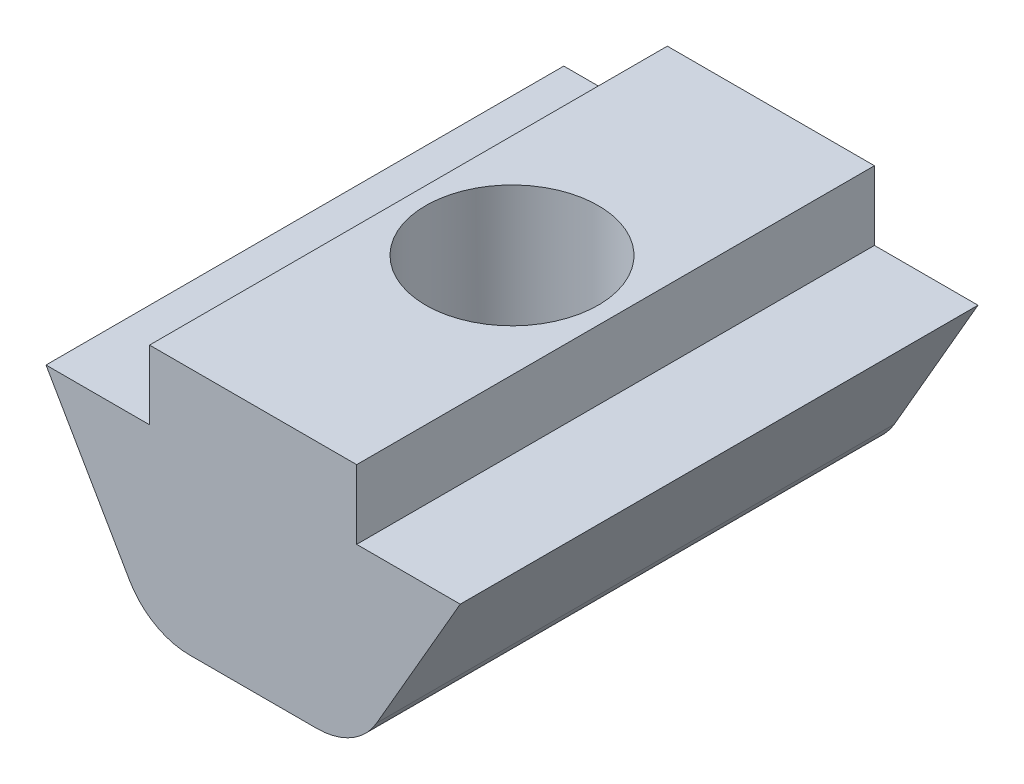
from build123d import *

# Parameters (mm, degrees)
BOSS_EXTRUDE1_DEPTH = 7.5
M6_TAPPED_HOLE1_D   = 5
FILLET1_R           = 2


with BuildPart() as part:
    # Sketch2 → Boss-Extrude1 (new, symmetric)
    with BuildSketch(Plane.XY):
        Polygon((-6, 5.196152423), (-3, 0), (3, 0), (6, 5.196152423), (3, 5.196152423), (3, 7.196152423), (-3, 7.196152423), (-3, 5.196152423), align=None)
    extrude(amount=BOSS_EXTRUDE1_DEPTH, both=True)

    # M6 Tapped Hole1 (through all)
    with Locations(Plane(origin=(0, 7.196152423, 0), x_dir=(1, 0, 0), z_dir=(0, 1, 0))):
        with Locations((0, 0)):
            Hole(M6_TAPPED_HOLE1_D / 2)

    # Fillet1
    # the kernel refuses this fillet: 2 mm, written as the material it takes off along each edge
    with BuildSketch(Plane(origin=(3, 0, -10.386751346), x_dir=(-1, 0, 0), z_dir=(0, 0, 1)), Plane(origin=(-3, 0, -10.386751346), x_dir=(-0.5000000000000046, 0.866025403784436, 0), z_dir=(0, 0, 1))) as fillet1_piece_1:
        with BuildLine():
            CenterArc((FILLET1_R * 0.57735026919, -FILLET1_R), FILLET1_R, 90, 60)
            Line((-FILLET1_R * 0.288675134595, -FILLET1_R * 0.5), (0, 0))
            Line((0, 0), (FILLET1_R * 0.57735026919, 0))
        make_face()
    extrude(amount=20.773502692, mode=Mode.SUBTRACT)


solid = part.part
